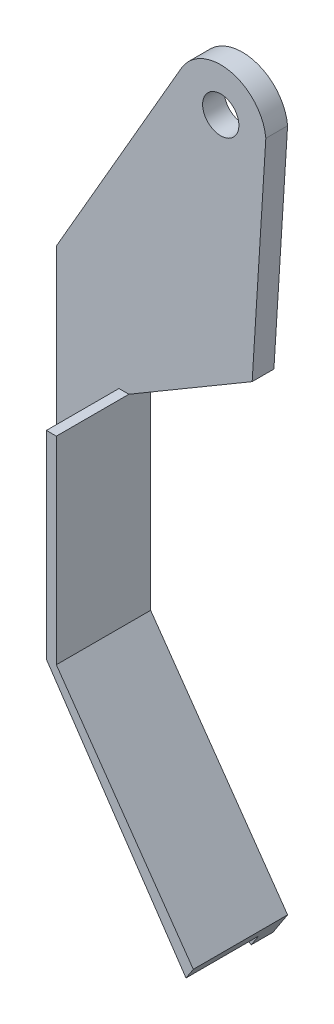
from build123d import *

# Parameters (mm, degrees)
EXTRUDE_4_DEPTH     = 3
SKETCH_2_R          = 2.5
CUT_EXTRUDE_1_DEPTH = 72.936469634
EXTRUDE_6_DEPTH     = 13


with BuildPart() as part:
    # 草图1 → 凸台-拉伸4 (new body)
    with BuildSketch(Plane.XY):
        with BuildLine():
            ThreePointArc((11.999755772, 64.190702015), (7.19287537, 69.699227744), (0.441332655, 66.894477154))
            Line((0.441332655, 66.894477154), (-16.87917542, 36.894477154))
            Line((-16.87917542, 36.894477154), (-16.87917542, -3.105522846))
            Line((-16.87917542, -3.105522846), (-5.332170037, -23.105522846))
            Line((-5.332170037, -23.105522846), (9.992741519, -33.105522846))
            Line((9.992741519, -33.105522846), (11.999755772, -30.029791253))
            Line((11.999755772, -30.029791253), (-6.87917542, -3.105522846))
            Line((-6.87917542, -3.105522846), (-6.87917542, 14.190702015))
            Line((-6.87917542, 14.190702015), (-6.87917542, 24.190702015))
            Line((-6.87917542, 24.190702015), (10.114332844, 34.190702015))
            Line((10.114332844, 34.190702015), (11.999755772, 64.190702015))
        make_face()
    extrude(amount=EXTRUDE_4_DEPTH)

    # 草图2 → 切除-拉伸1 (cut, through all)
    with BuildSketch(Plane.XY):
        with Locations((5.784422652, 63.881230161)):
            Circle(SKETCH_2_R)
    extrude(amount=CUT_EXTRUDE_1_DEPTH, mode=Mode.SUBTRACT)

    # 草图6 → 凸台-拉伸6 (add)
    with BuildSketch(Plane(origin=(0, 0, 0), x_dir=(-1, 0, 0), z_dir=(0, 0, -1))):
        Polygon((6.87917542, 24.190702015), (8.248400541, 24.190702015), (8.248400541, -3.145484966), (-10.996248645, -31.567657049), (-11.999755772, -30.029791253), (6.87917542, -3.105522846), align=None)
    extrude(amount=-EXTRUDE_6_DEPTH)


solid = part.part
